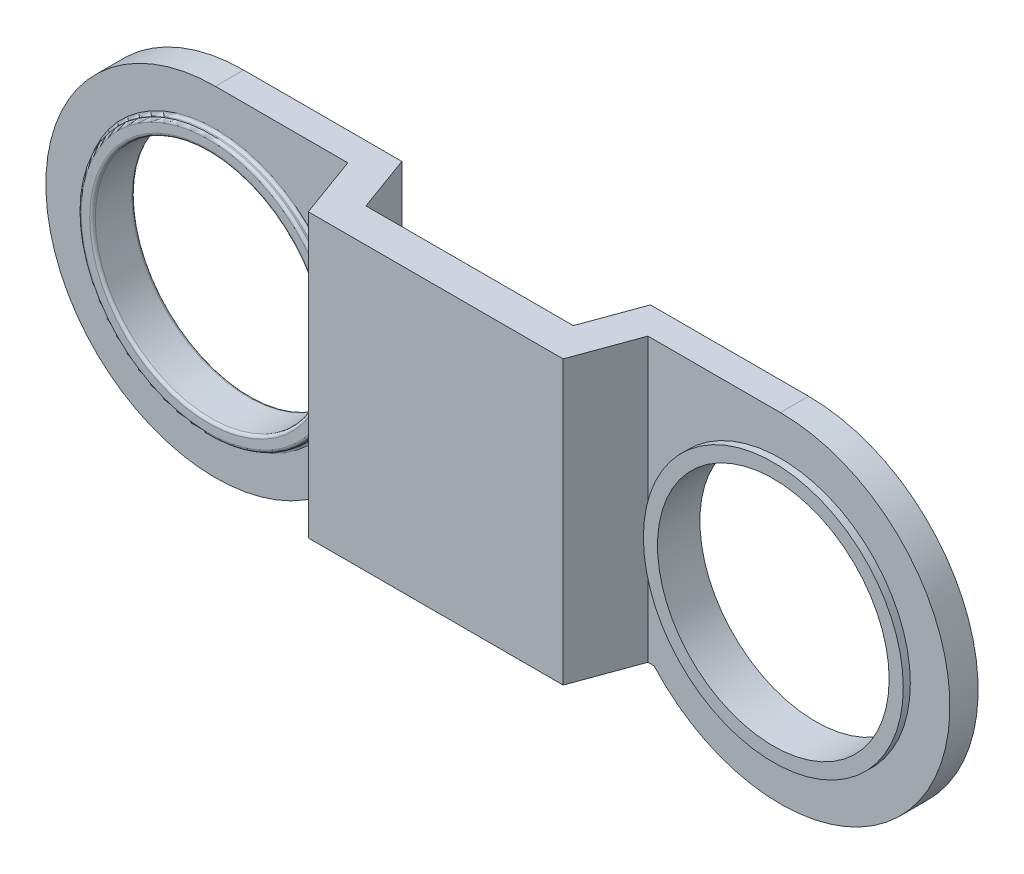
from build123d import *

# Parameters (mm, degrees)
SKETCH1_R           = 41
BOSS_EXTRUDE1_DEPTH = 20
CUT_EXTRUDE1_DEPTH  = 102
SKETCH3_R           = 46
SKETCH3_R_2         = 41
BOSS_EXTRUDE2_DEPTH = 7.5
FILLET1_R           = 1


with BuildPart() as part:
    # Sketch1 → Boss-Extrude1 (new, symmetric)
    with BuildSketch(Plane.XY):
        with BuildLine():
            Line((-100, 60), (100, 60))
            ThreePointArc((100, 60), (154.772255751, -24.494897428), (55.27864045, -40))
            Line((55.27864045, -40), (-55.27864045, -40))
            ThreePointArc((-55.27864045, -40), (-154.772255751, -24.494897428), (-100, 60))
        make_face()
        with Locations((100, 0)):
            Circle(SKETCH1_R, mode=Mode.SUBTRACT)
        with Locations(Location((-100, 0, 0), (0, 0, 180))):
            Circle(SKETCH1_R, mode=Mode.SUBTRACT)
    extrude(amount=BOSS_EXTRUDE1_DEPTH, both=True)

    # Sketch2 → Cut-Extrude1 (cut, symmetric)
    with BuildSketch(Plane(origin=(0, 0, 0), x_dir=(1, 0, 0), z_dir=(0, 1, 0))):
        Polygon((0, 0), (-36.702509541, 0), (-43.981914227, 20), (43.981914227, 20), (36.702509541, 0), align=None)
        Polygon((0, -12), (-45.105, -12), (-53.112345154, 10), (-160, 10), (-160, -20), (160, -20), (160, 10), (53.112345154, 10), (45.105, -12), align=None)
    extrude(amount=CUT_EXTRUDE1_DEPTH, both=True, mode=Mode.SUBTRACT)

    # Sketch3 → Boss-Extrude2 (add, symmetric)
    # profile 1 of 2: a face of its own
    with BuildSketch(Plane(origin=(0, 0, -15), x_dir=(-1, 0, 0), z_dir=(0, 0, -1))):
        with Locations((100, 0)):
            Circle(SKETCH3_R)
        with Locations((100, 0)):
            Circle(SKETCH3_R_2, mode=Mode.SUBTRACT)
    # profile 2 of 2: a face of its own
    with BuildSketch(Plane(origin=(0, 0, -15), x_dir=(-1, 0, 0), z_dir=(0, 0, -1))):
        with Locations(Location((-100, 0, 0), (0, 0, 180))):
            Circle(SKETCH3_R)
        with Locations(Location((-100, 0, 0), (0, 0, 180))):
            Circle(SKETCH3_R_2, mode=Mode.SUBTRACT)
    extrude(amount=BOSS_EXTRUDE2_DEPTH, both=True)

    # Fillet1
    # the kernel refuses this fillet: 1 mm, written as the material it adds along each edge
    with BuildSketch(Plane(origin=(-100, 0, -10), x_dir=(-1, 0, 0), z_dir=(0, -1, 0))) as fillet1_piece_1:
        with BuildLine():
            CenterArc((46 + FILLET1_R, -FILLET1_R), FILLET1_R, 90, 90)
            Line((46 + FILLET1_R, 0), (46, 0))
            Line((46, 0), (46, -FILLET1_R))
        make_face()
    revolve(axis=Axis((-100, 0, -10), (0, 0, -1)))
    with BuildSketch(Plane(origin=(-100, 0, -20), x_dir=(-1, 0, 0), z_dir=(0, -1, 0))) as fillet1_piece_2:
        with BuildLine():
            CenterArc((46 + FILLET1_R, FILLET1_R), FILLET1_R, 180, 90)
            Line((46, FILLET1_R), (46, 0))
            Line((46, 0), (46 + FILLET1_R, 0))
        make_face()
    revolve(axis=Axis((-100, 0, -20), (0, 0, -1)))
    # the kernel refuses this fillet: 1 mm, written as the material it takes off along each edge
    with BuildSketch(Plane(origin=(-100, 0, -7.5), x_dir=(-1, 0, 0), z_dir=(0, -1, 0))) as fillet1_2_piece_1:
        with BuildLine():
            CenterArc((46 - FILLET1_R, FILLET1_R), FILLET1_R, 270, 90)
            Line((46 - FILLET1_R, 0), (46, 0))
            Line((46, 0), (46, FILLET1_R))
        make_face()
    revolve(axis=Axis((-100, 0, -7.5), (0, 0, -1)), mode=Mode.SUBTRACT)
    with BuildSketch(Plane(origin=(-100, 0, -22.5), x_dir=(-1, 0, 0), z_dir=(0, -1, 0))) as fillet1_2_piece_2:
        with BuildLine():
            CenterArc((41 + FILLET1_R, -FILLET1_R), FILLET1_R, 90, 90)
            Line((41, -FILLET1_R), (41, 0))
            Line((41, 0), (41 + FILLET1_R, 0))
        make_face()
    revolve(axis=Axis((-100, 0, -22.5), (0, 0, -1)), mode=Mode.SUBTRACT)
    with BuildSketch(Plane(origin=(-100, 0, -22.5), x_dir=(-1, 0, 0), z_dir=(0, -1, 0))) as fillet1_2_piece_3:
        with BuildLine():
            CenterArc((46 - FILLET1_R, -FILLET1_R), FILLET1_R, 0, 90)
            Line((46 - FILLET1_R, 0), (46, 0))
            Line((46, 0), (46, -FILLET1_R))
        make_face()
    revolve(axis=Axis((-100, 0, -22.5), (0, 0, -1)), mode=Mode.SUBTRACT)
    with BuildSketch(Plane(origin=(-100, 0, -7.5), x_dir=(-1, 0, 0), z_dir=(0, -1, 0))) as fillet1_2_piece_4:
        with BuildLine():
            CenterArc((41 + FILLET1_R, FILLET1_R), FILLET1_R, 180, 90)
            Line((41, FILLET1_R), (41, 0))
            Line((41, 0), (41 + FILLET1_R, 0))
        make_face()
    revolve(axis=Axis((-100, 0, -7.5), (0, 0, -1)), mode=Mode.SUBTRACT)


solid = part.part
